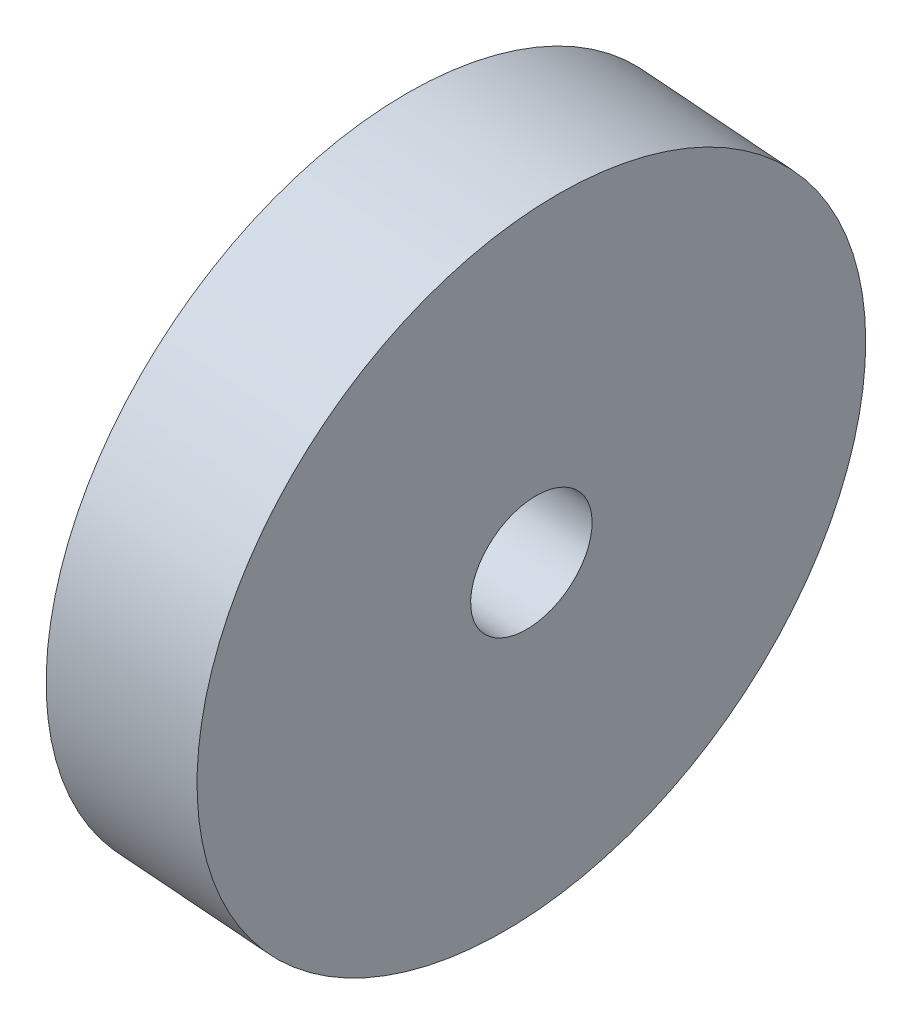
from build123d import *

# Parameters (mm, degrees)
SKETCH1_R           = 13.9827
BOSS_EXTRUDE1_DEPTH = 6.35
SKETCH2_R           = 2.54
CUT_EXTRUDE1_DEPTH  = 5.08


with BuildPart() as part:
    # Sketch1 → Boss-Extrude1 (new body)
    with BuildSketch(Plane(origin=(234.278878836, -18.689027227, 0), x_dir=(0, 0, -1), z_dir=(0.9968332748770866, -0.0795199477981641, 0))):
        with Locations((-43.174261814, 8.550344032)):
            Circle(SKETCH1_R)
    extrude(amount=-BOSS_EXTRUDE1_DEPTH)

    # Sketch2 → Cut-Extrude1 (cut)
    with BuildSketch(Plane(origin=(234.278878836, -18.689027227, 0), x_dir=(0, 0, -1), z_dir=(0.9968332748770866, -0.07951994779816411, 0))):
        with Locations((-43.174261814, 8.550344032)):
            Circle(SKETCH2_R)
    extrude(amount=-CUT_EXTRUDE1_DEPTH, mode=Mode.SUBTRACT)


solid = part.part
